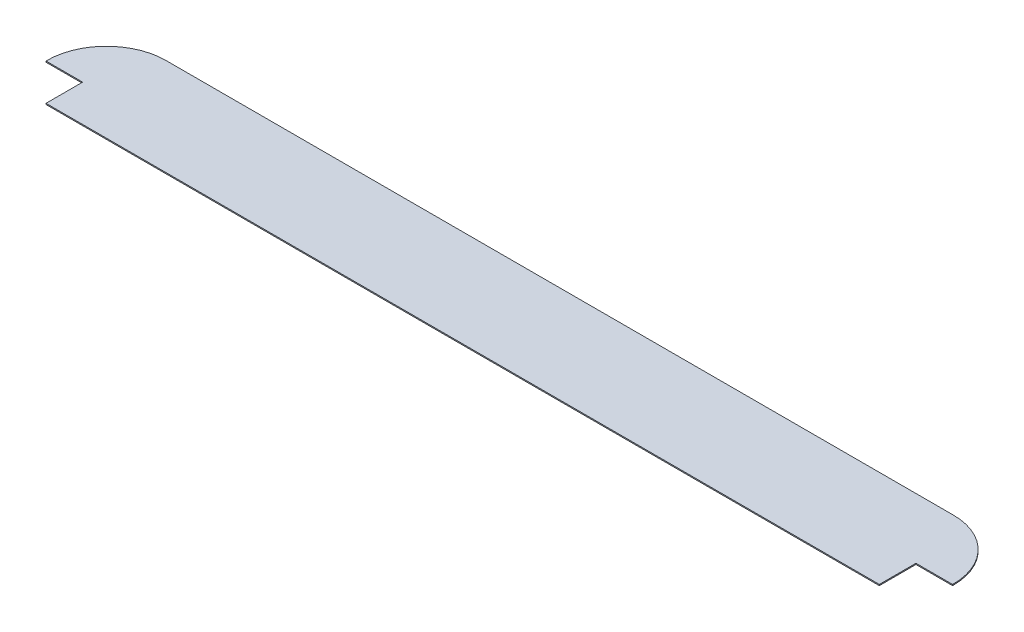
from build123d import *

# Parameters (mm, degrees)
BASE_FLANGE1_DEPTH = 1.2


# Sheet-metal steps are written as plain solids
with BuildPart() as part:
    # Sketch1 → Base-Flange1 (new body)
    with BuildSketch(Plane(origin=(0, 0, 0), x_dir=(1, 0, 0), z_dir=(0, 1, 0))):
        with BuildLine():
            Line((-455, -53), (455, -53))
            Line((455, -53), (455, -13))
            Line((455, -13), (495, -13))
            Line((495, -13), (495, -12))
            ThreePointArc((495, -12), (475.961940777, 33.961940777), (430, 53))
            Line((430, 53), (-430, 53))
            ThreePointArc((-430, 53), (-475.961940777, 33.961940777), (-495, -12))
            Line((-495, -12), (-495, -13))
            Line((-495, -13), (-455, -13))
            Line((-455, -13), (-455, -53))
        make_face()
    extrude(amount=-BASE_FLANGE1_DEPTH)


solid = part.part
